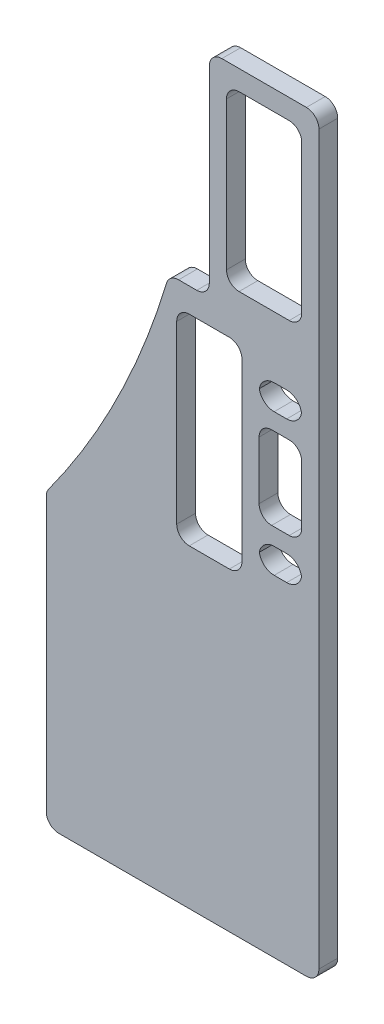
from build123d import *

# Parameters (mm, degrees)
SKETCH1_W           = 108.7
SKETCH1_H           = 300
BOSS_EXTRUDE1_DEPTH = 7.5
SKETCH2_W           = 65
SKETCH2_H           = 85
CUT_EXTRUDE1_DEPTH  = 7.5
CUT_EXTRUDE2_DEPTH  = 7.5
SKETCH5_W           = 30
SKETCH5_H           = 69
CUT_EXTRUDE3_DEPTH  = 7.5
SKETCH6_W           = 26
SKETCH6_H           = 80
CUT_EXTRUDE4_DEPTH  = 7.5
SKETCH9_W           = 17
SKETCH9_H           = 33
CUT_EXTRUDE5_DEPTH  = 7.5
SKETCH10_W          = 17
SKETCH10_H          = 10
CUT_EXTRUDE6_DEPTH  = 7.5
FILLET3_R           = 5
FILLET4_R           = 6


with BuildPart() as part:
    # Sketch1 → Boss-Extrude1 (new body)
    with BuildSketch(Plane.XY):
        Rectangle(SKETCH1_W, SKETCH1_H)
    extrude(amount=BOSS_EXTRUDE1_DEPTH)

    # Sketch2 → Cut-Extrude1 (cut)
    with BuildSketch(Plane.XY.offset(7.5)):
        with Locations((-21.85, 107.5)):
            Rectangle(SKETCH2_W, SKETCH2_H)
    extrude(amount=-CUT_EXTRUDE1_DEPTH, mode=Mode.SUBTRACT)

    # Sketch4 → Cut-Extrude2 (cut)
    with BuildSketch(Plane.XY.offset(7.5)):
        with BuildLine():
            Line((-54.35, 65), (-54.35, -34.475529761))
            ThreePointArc((-54.35, -34.475529761), (-25.449157059, 13.098498105), (-5.32998831, 65))
            Line((-5.32998831, 65), (-54.35, 65))
        make_face()
    extrude(amount=-CUT_EXTRUDE2_DEPTH, mode=Mode.SUBTRACT)

    # Sketch5 → Cut-Extrude3 (cut)
    with BuildSketch(Plane.XY.offset(7.5)):
        with Locations((32.5, 107.5)):
            Rectangle(SKETCH5_W, SKETCH5_H)
    extrude(amount=-CUT_EXTRUDE3_DEPTH, mode=Mode.SUBTRACT)

    # Sketch6 → Cut-Extrude4 (cut)
    with BuildSketch(Plane.XY.offset(7.5)):
        with Locations((10.65, 15.262235119)):
            Rectangle(SKETCH6_W, SKETCH6_H)
    extrude(amount=-CUT_EXTRUDE4_DEPTH, mode=Mode.SUBTRACT)

    # Sketch9 → Cut-Extrude5 (cut)
    with BuildSketch(Plane.XY.offset(7.5)):
        with Locations((39, 15.262235119)):
            Rectangle(SKETCH9_W, SKETCH9_H)
    extrude(amount=-CUT_EXTRUDE5_DEPTH, mode=Mode.SUBTRACT)

    # Sketch10 → Cut-Extrude6 (cut)
    with BuildSketch(Plane.XY.offset(7.5)):
        with Locations((39, 43.512235119)):
            Rectangle(SKETCH10_W, SKETCH10_H)
        with Locations((39, -12.987764881)):
            Rectangle(SKETCH10_W, SKETCH10_H)
    extrude(amount=-CUT_EXTRUDE6_DEPTH, mode=Mode.SUBTRACT)

    # Fillet3
    fillet3_edges = [part.edges().sort_by_distance(p)[0] for p in [
        (10.65, 150, 3.75),
        (10.65, 65, 3.75),
        (-5.32998831, 65, 3.75),
        (-54.35, -34.475529761, 3.75),
        (47.5, 142, 3.75),
        (47.5, 73, 3.75),
        (17.5, 73, 3.75),
        (17.5, 142, 3.75),
        (23.65, 55.262235119, 3.75),
        (23.65, -24.737764881, 3.75),
        (-2.35, -24.737764881, 3.75),
        (-2.35, 55.262235119, 3.75),
        (54.35, -150, 3.75),
        (-54.35, -150, 3.75),
        (47.5, 31.762235119, 3.75),
        (47.5, -1.237764881, 3.75),
        (30.5, -1.237764881, 3.75),
        (30.5, 31.762235119, 3.75),
        (54.35, 150, 3.75),
    ]]
    fillet(fillet3_edges, radius=FILLET3_R)

    # Fillet4
    # the kernel refuses this fillet: 6 mm, written as the material it adds along each edge
    with BuildSketch(Plane(origin=(47.5, -17.987764881, 7.5), x_dir=(0, 1, 0), z_dir=(0, 0, -1)), Plane(origin=(47.5, -7.987764881, 7.5), x_dir=(-1, 0, 0), z_dir=(0, 0, -1)), Plane(origin=(30.5, -17.987764881, 7.5), x_dir=(1, 0, 0), z_dir=(0, 0, -1)), Plane(origin=(47.5, 38.512235119, 7.5), x_dir=(0, 1, 0), z_dir=(0, 0, -1)), Plane(origin=(30.5, 38.512235119, 7.5), x_dir=(1, 0, 0), z_dir=(0, 0, -1)), Plane(origin=(47.5, 48.512235119, 7.5), x_dir=(-1, 0, 0), z_dir=(0, 0, -1))) as fillet4_piece_1:
        with BuildLine():
            CenterArc((FILLET4_R, -FILLET4_R), FILLET4_R, 90, 90)
            Line((0, -FILLET4_R), (0, 0))
            Line((0, 0), (FILLET4_R, 0))
        make_face()
    extrude(amount=7.5)
    with BuildSketch(Plane(origin=(30.5, -7.987764881, 7.5), x_dir=(1, 0, 0), z_dir=(0, 0, -1)), Plane(origin=(30.5, 48.512235119, 7.5), x_dir=(1, 0, 0), z_dir=(0, 0, -1))) as fillet4_piece_2:
        with BuildLine():
            CenterArc((FILLET4_R, FILLET4_R), FILLET4_R, 180, 90)
            Line((0, FILLET4_R), (0, 0))
            Line((0, 0), (FILLET4_R, 0))
        make_face()
    extrude(amount=7.5)


solid = part.part
